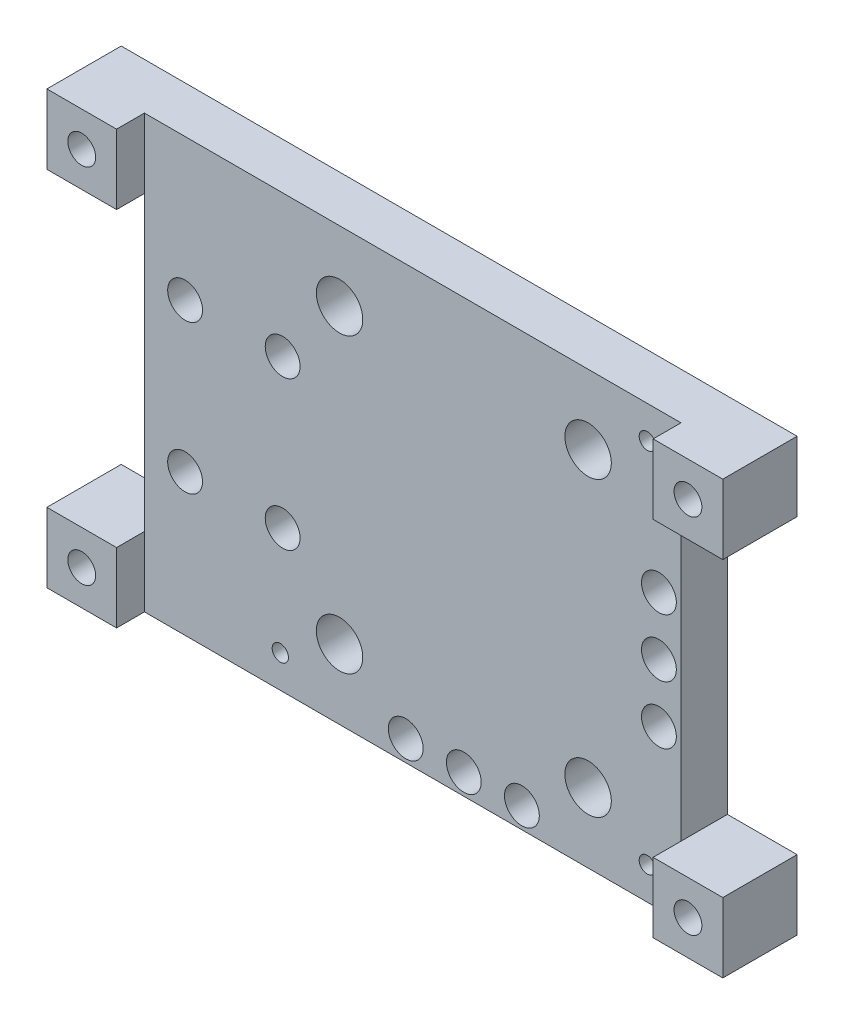
from build123d import *

# Parameters (mm, degrees)
SKETCH_1_W          = 23.1
SKETCH_1_H          = 18.6
EXTRUDE_1_DEPTH     = 2
SKETCH_2_R          = 0.75
SKETCH_2_R_2        = 1
SKETCH_2_R_3        = 0.35
CUT_EXTRUDE_1_DEPTH = 15.963037793
SKETCH_3_W          = 3
SKETCH_3_H          = 3
SKETCH_3_R          = 0.6
EXTRUDE_2_DEPTH     = 3.2
SKETCH_3_3_R        = 1
CUT_EXTRUDE_2_DEPTH = 1.5


with BuildPart() as part:
    # 草图1 → 凸台-拉伸1 (new body)
    with BuildSketch(Plane.XY):
        Rectangle(SKETCH_1_W, SKETCH_1_H)
    extrude(amount=EXTRUDE_1_DEPTH)

    # 草图2 → 切除-拉伸1 (cut, through all)
    with BuildSketch(Plane(origin=(0, 0, 0), x_dir=(-1, 0, 0), z_dir=(0, 0, -1))):
        with Locations((-10.6, 2.5)):
            Circle(SKETCH_2_R)
        with Locations((-10.6, 0)):
            Circle(SKETCH_2_R)
        with Locations((-10.6, -2.5)):
            Circle(SKETCH_2_R)
        with Locations((-7.55, -6.3)):
            Circle(SKETCH_2_R_2)
        with Locations((3.15, -6.3)):
            Circle(SKETCH_2_R_2)
        with Locations((-4.7, -8.4)):
            Circle(SKETCH_2_R)
        with Locations((-2.2, -8.4)):
            Circle(SKETCH_2_R)
        with Locations((0.3, -8.4)):
            Circle(SKETCH_2_R)
        with Locations((-7.55, 6.3)):
            Circle(SKETCH_2_R_2)
        with Locations((3.15, 6.3)):
            Circle(SKETCH_2_R_2)
        with Locations((5.6, 3.2)):
            Circle(SKETCH_2_R)
        with Locations((9.8, 3.2)):
            Circle(SKETCH_2_R)
        with Locations((5.6, -3.2)):
            Circle(SKETCH_2_R)
        with Locations((9.8, -3.2)):
            Circle(SKETCH_2_R)
        with Locations((5.7, -7.9)):
            Circle(SKETCH_2_R_3)
        with Locations((-10.1, -7.9)):
            Circle(SKETCH_2_R_3)
        with Locations((-10.1, 7.9)):
            Circle(SKETCH_2_R_3)
    extrude(amount=-CUT_EXTRUDE_1_DEPTH, mode=Mode.SUBTRACT)

    # 草图3 → 凸台-拉伸2 (add)
    # profile 1 of 4: a face of its own
    with BuildSketch(Plane(origin=(0, 0, 0), x_dir=(-1, 0, 0), z_dir=(0, 0, -1))):
        with Locations((-13.05, 7.8)):
            Rectangle(SKETCH_3_W, SKETCH_3_H)
        with Locations((-13.05, 7.8)):
            Circle(SKETCH_3_R, mode=Mode.SUBTRACT)
    # profile 2 of 4: a face of its own
    with BuildSketch(Plane(origin=(0, 0, 0), x_dir=(-1, 0, 0), z_dir=(0, 0, -1))):
        with Locations((-13.05, -7.8)):
            Rectangle(SKETCH_3_W, SKETCH_3_H)
        with Locations((-13.05, -7.8)):
            Circle(SKETCH_3_R, mode=Mode.SUBTRACT)
    # profile 3 of 4: a face of its own
    with BuildSketch(Plane(origin=(0, 0, 0), x_dir=(-1, 0, 0), z_dir=(0, 0, -1))):
        with Locations((13.05, 7.8)):
            Rectangle(SKETCH_3_W, SKETCH_3_H)
        with Locations((13.05, 7.8)):
            Circle(SKETCH_3_R, mode=Mode.SUBTRACT)
    # profile 4 of 4: a face of its own
    with BuildSketch(Plane(origin=(0, 0, 0), x_dir=(-1, 0, 0), z_dir=(0, 0, -1))):
        with Locations((13.05, -7.8)):
            Rectangle(SKETCH_3_W, SKETCH_3_H)
        with Locations((13.05, -7.8)):
            Circle(SKETCH_3_R, mode=Mode.SUBTRACT)
    extrude(amount=-EXTRUDE_2_DEPTH)

    # 草图3<3> → 切除-拉伸2 (cut)
    with BuildSketch(Plane(origin=(0, 0, 0), x_dir=(-1, 0, 0), z_dir=(0, 0, -1))):
        with Locations((-13.05, 7.8)):
            Circle(SKETCH_3_3_R)
        with Locations((-13.05, -7.8)):
            Circle(SKETCH_3_3_R)
        with Locations((13.05, -7.8)):
            Circle(SKETCH_3_3_R)
        with Locations((13.05, 7.8)):
            Circle(SKETCH_3_3_R)
    extrude(amount=-CUT_EXTRUDE_2_DEPTH, mode=Mode.SUBTRACT)


solid = part.part
